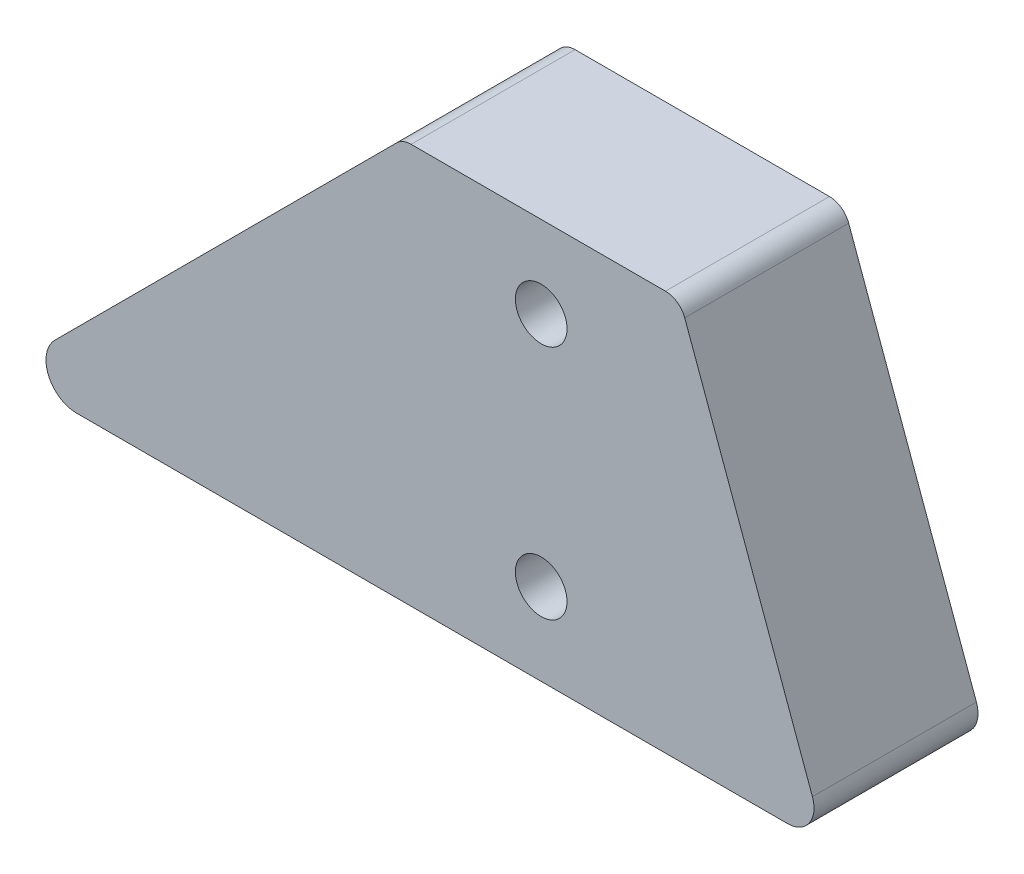
from build123d import *

# Parameters (mm, degrees)
BOSS_EXTRUDE1_DEPTH      = 20
BOSS_EXTRUDE1_DEPTH_BACK = 20
SKETCH1_R                = 6.3


with BuildPart() as part:
    # Sketch1 → Boss-Extrude1 (new, two sides: drawn at the far end of the back side and taken through both)
    with BuildSketch(Plane.XY.offset(-BOSS_EXTRUDE1_DEPTH_BACK)):
        with BuildLine():
            Line((-14.2875, -45), (45.765532821, -45))
            ThreePointArc((45.765532821, -45), (51.090021108, -42.228246836), (51.873534856, -36.276869068))
            Line((51.873534856, -36.276869068), (20.722425413, 49.310100717))
            ThreePointArc((20.722425413, 49.310100717), (18.891844491, 51.695760221), (16.023962309, 52.6))
            Line((16.023962309, 52.6), (-46.028932188, 52.6))
            ThreePointArc((-46.028932188, 52.6), (-47.94234935, 52.219397663), (-49.564466094, 51.135533906))
            Line((-49.564466094, 51.135533906), (-132.896699141, -32.196699141))
            ThreePointArc((-132.896699141, -32.196699141), (-134.522494776, -40.370125743), (-127.593398282, -45))
            Line((-127.593398282, -45), (-14.2875, -45))
        make_face()
        with BuildLine():
            ThreePointArc((-7.9875, -25), (-9.832727279, -29.454772721), (-14.2875, -31.3))
            ThreePointArc((-14.2875, -31.3), (-20.5875, -25), (-14.2875, -18.7))
            ThreePointArc((-14.2875, -18.7), (-9.832727279, -20.545227279), (-7.9875, -25))
        make_face(mode=Mode.SUBTRACT)
        with Locations((-14.2875, 32.625)):
            Circle(SKETCH1_R, mode=Mode.SUBTRACT)
    extrude(amount=BOSS_EXTRUDE1_DEPTH + BOSS_EXTRUDE1_DEPTH_BACK)


solid = part.part
